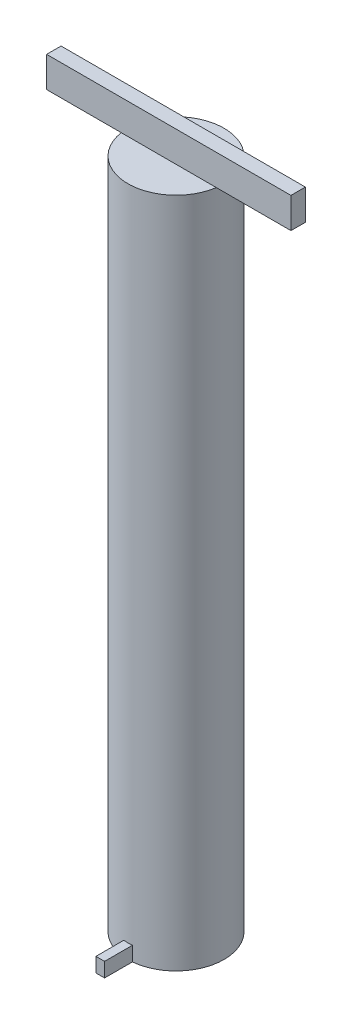
from build123d import *

# Parameters (mm, degrees)
SKETCH1_R           = 10
BOSS_EXTRUDE1_DEPTH = 139.7
BOSS_EXTRUDE2_DEPTH = 3
SKETCH4_W           = 50.8
SKETCH4_H           = 3
BOSS_EXTRUDE3_DEPTH = 6.35
SKETCH5_R           = 6.25
CUT_EXTRUDE1_DEPTH  = 4


with BuildPart() as part:
    # Sketch1 → Boss-Extrude1 (new body)
    with BuildSketch(Plane(origin=(0, 0, 0), x_dir=(1, 0, 0), z_dir=(0, 1, 0))):
        Circle(SKETCH1_R)
    extrude(amount=BOSS_EXTRUDE1_DEPTH)

    # Sketch3 → Boss-Extrude2 (add)
    with BuildSketch(Plane.XZ):
        with BuildLine():
            Line((-0.9, 15.75), (0.9, 15.75))
            Line((0.9, 15.75), (0.9, 9.354806465))
            ThreePointArc((0.9, 9.354806465), (0, 9.398), (-0.9, 9.354806465))
            Line((-0.9, 9.354806465), (-0.9, 15.75))
        make_face()
    extrude(amount=-BOSS_EXTRUDE2_DEPTH)

    # Sketch4 → Boss-Extrude3 (add)
    with BuildSketch(Plane(origin=(0, 139.7, 0), x_dir=(1, 0, 0), z_dir=(0, 1, 0))):
        Rectangle(SKETCH4_W, SKETCH4_H)
    extrude(amount=BOSS_EXTRUDE3_DEPTH)

    # Sketch5 → Cut-Extrude1 (cut)
    with BuildSketch(Plane.XZ):
        Circle(SKETCH5_R)
    extrude(amount=-CUT_EXTRUDE1_DEPTH, mode=Mode.SUBTRACT)


solid = part.part
